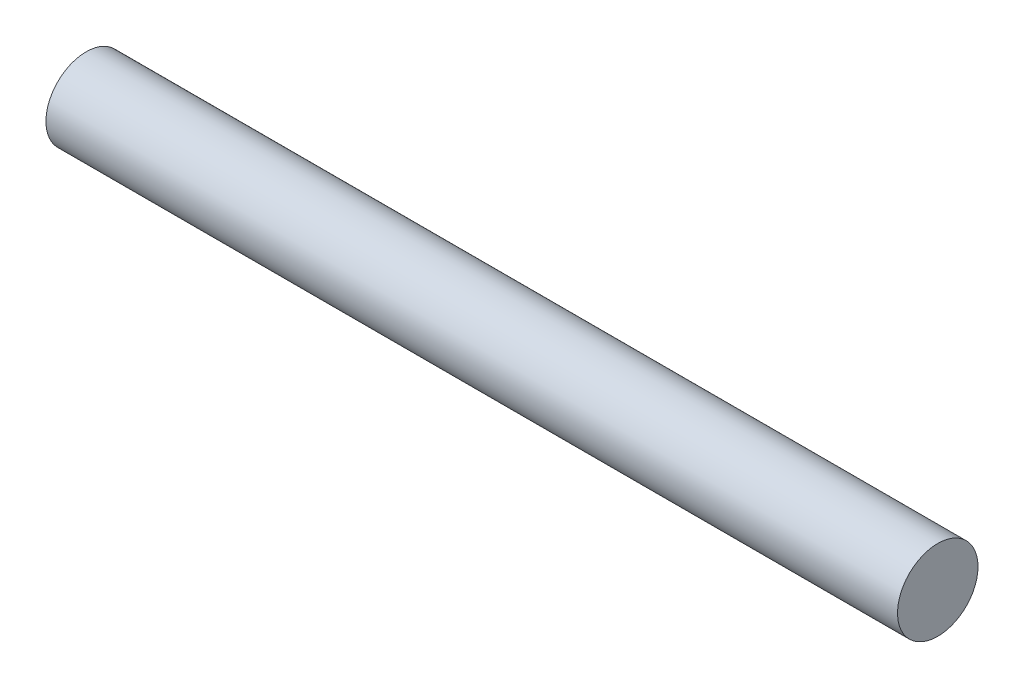
from build123d import *

# Parameters (mm, degrees)
SKETCH1_R           = 3
BOSS_EXTRUDE1_DEPTH = 63.5


with BuildPart() as part:
    # Sketch1 → Boss-Extrude1 (new body)
    with BuildSketch(Plane(origin=(0, 0, 0), x_dir=(0, 0, -1), z_dir=(1, 0, 0))):
        Circle(SKETCH1_R)
    extrude(amount=BOSS_EXTRUDE1_DEPTH)


solid = part.part
